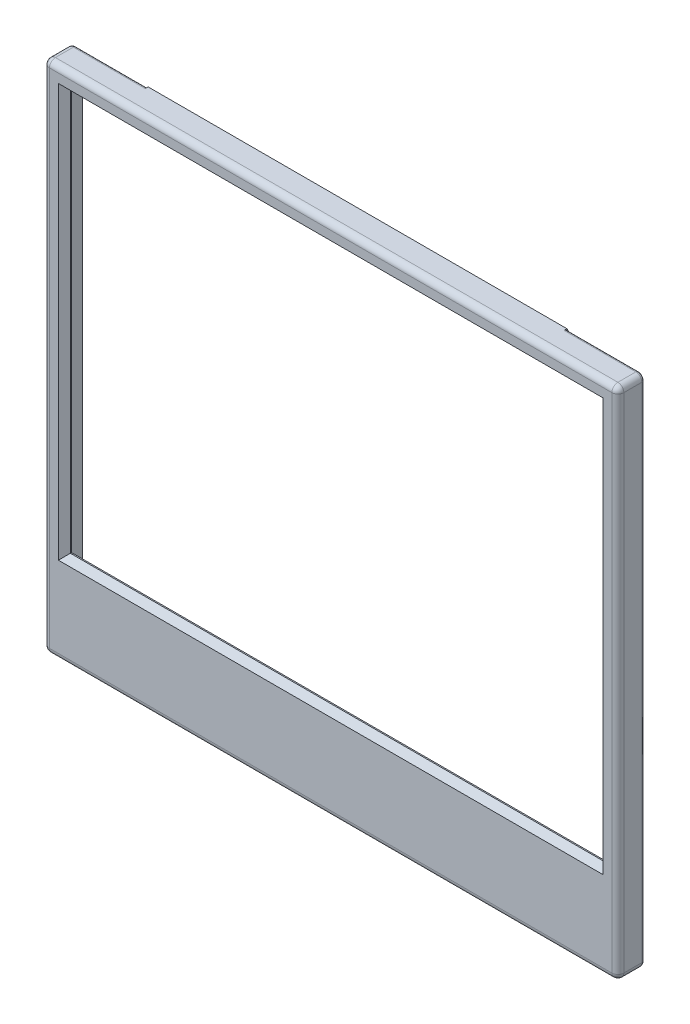
from build123d import *
from OCP.BRepFilletAPI import BRepFilletAPI_MakeChamfer

# Parameters (mm, degrees)
SKETCH1_W           = 96
SKETCH1_H           = 86
SKETCH1_W_2         = 89
SKETCH1_H_2         = 67
BOSS_EXTRUDE1_DEPTH = 4.5
SKETCH2_W           = 92
SKETCH2_H           = 78
CUT_EXTRUDE1_DEPTH  = 3.3
CHAMFER1_SIZE       = 1
SKETCH3_W           = 14.8
SKETCH3_H           = 6
BOSS_EXTRUDE2_DEPTH = 6
SKETCH4_R           = 1.5
CUT_EXTRUDE2_DEPTH  = 111.902705107
FILLET1_R           = 1
SKETCH6_W           = 10
SKETCH6_H           = 4.2
BOSS_EXTRUDE3_DEPTH = 1
CHAMFER2_SIZE       = 1
CHAMFER2_SIZE2      = 1.962610506
CHAMFER3_SIZE       = 0.5
CHAMFER3_SIZE2      = 0.419549816
FILLET2_R           = 0.5
FILLET3_R           = 0.5
SKETCH7_W           = 8
SKETCH7_H           = 1.5
BOSS_EXTRUDE4_DEPTH = 1.25
CHAMFER4_SIZE       = 0.5
CHAMFER4_SIZE2      = 0.419549816
FILLET6_R           = 0.5


# Some blends are built 0.0001 mm under size
with BuildPart() as part:
    # Sketch1 → Boss-Extrude1 (new body)
    with BuildSketch(Plane.XY):
        with Locations((44.5, 27.5)):
            Rectangle(SKETCH1_W, SKETCH1_H)
        with Locations((44.5, 33.5)):
            Rectangle(SKETCH1_W_2, SKETCH1_H_2, mode=Mode.SUBTRACT)
    extrude(amount=BOSS_EXTRUDE1_DEPTH)

    # Sketch2 → Cut-Extrude1 (cut)
    with BuildSketch(Plane(origin=(0, 0, 0), x_dir=(-1, 0, 0), z_dir=(0, 0, -1))):
        with Locations((-44.5, 29.5)):
            Rectangle(SKETCH2_W, SKETCH2_H)
    extrude(amount=-CUT_EXTRUDE1_DEPTH, mode=Mode.SUBTRACT)

    # Chamfer1
    chamfer1_edges = [part.edges().sort_by_distance(p)[0] for p in [
        (0, 33.5, 4.5),
        (44.5, 0, 4.5),
        (89, 33.5, 4.5),
        (44.5, 67, 4.5),
    ]]
    chamfer(chamfer1_edges, length=CHAMFER1_SIZE)

    # Sketch3 → Boss-Extrude2 (add)
    with BuildSketch(Plane(origin=(0, 0, 0), x_dir=(-1, 0, 0), z_dir=(0, 0, -1))):
        with Locations((-14.5, -12.5)):
            Rectangle(SKETCH3_W, SKETCH3_H)
        with Locations((-74.5, -12.5)):
            Rectangle(SKETCH3_W, SKETCH3_H)
        with Locations((-44.5, -12.5)):
            Rectangle(SKETCH3_W, SKETCH3_H)
    extrude(amount=BOSS_EXTRUDE2_DEPTH)

    # Sketch4 → Cut-Extrude2 (cut, through all)
    with BuildSketch(Plane.ZY.offset(-7.1)):
        with BuildLine():
            ThreePointArc((-6, -12.5), (-5.121320344, -10.378679656), (-3, -9.5))
            Line((-3, -9.5), (-6, -9.5))
            Line((-6, -9.5), (-6, -12.5))
        make_face()
        with BuildLine():
            ThreePointArc((-3, -15.5), (-5.121320344, -14.621320344), (-6, -12.5))
            Line((-6, -12.5), (-6, -15.5))
            Line((-6, -15.5), (-3, -15.5))
        make_face()
        with Locations((-3, -12.5)):
            Circle(SKETCH4_R)
    extrude(amount=-CUT_EXTRUDE2_DEPTH, mode=Mode.SUBTRACT)

    # Fillet1
    fillet1_edges = [part.edges().sort_by_distance(p)[0] for p in [
        (92.5, 27.5, 4.5),
        (44.5, 70.5, 4.5),
        (-3.5, 27.5, 4.5),
        (-3.5, 70.5, 2.25),
        (92.5, 70.5, 2.25),
        (92.5, -15.5, 2.25),
        (-3.5, -15.5, 2.25),
        (44.5, -15.5, 4.5),
    ]]
    fillet(fillet1_edges, radius=FILLET1_R)

    # Sketch6 → Boss-Extrude3 (add)
    with BuildSketch(Plane(origin=(0, 0, 0), x_dir=(-1, 0, 0), z_dir=(0, 0, -1))):
        with Locations((-74.5, 68.4)):
            Rectangle(SKETCH6_W, SKETCH6_H)
        with Locations((-14.5, 68.4)):
            Rectangle(SKETCH6_W, SKETCH6_H)
        with Locations((-44.5, 68.4)):
            Rectangle(SKETCH6_W, SKETCH6_H)
    extrude(amount=BOSS_EXTRUDE3_DEPTH)

    # Chamfer2
    chamfer2_edges = [part.edges().sort_by_distance(p)[0] for p in [
        (14.5, 70.5, -1),
        (44.5, 70.5, -1),
        (74.5, 70.5, -1),
    ]]
    chamfer2_side = [part.faces().sort_by_distance(p)[0] for p in [
        (44.5, 70.5, 1.561977716),
    ]]
    chamfer(chamfer2_edges, length=CHAMFER2_SIZE, length2=CHAMFER2_SIZE2, reference=chamfer2_side[0])

    # Chamfer3: one chamfer whose edges measure the first distance from different faces: ONE call of the kernel's chamfer builder (chamfer() names one face for all edges)
    chamfer3_edges_1 = [part.edges().sort_by_distance(p)[0] for p in [
        (74.5, 66.3, 0),
    ]]
    chamfer3_side_1 = [part.faces().sort_by_distance(p)[0] for p in [
        (74.5, 67.4, 0),
    ]]
    chamfer3_edges_2 = [part.edges().sort_by_distance(p)[0] for p in [
        (14.5, 66.3, 0),
    ]]
    chamfer3_side_2 = [part.faces().sort_by_distance(p)[0] for p in [
        (14.5, 67.4, 0),
    ]]
    chamfer3_edges_3 = [part.edges().sort_by_distance(p)[0] for p in [
        (44.5, 66.3, 0),
    ]]
    chamfer3_side_3 = [part.faces().sort_by_distance(p)[0] for p in [
        (44.5, 67.4, 0),
    ]]
    chamfer3 = BRepFilletAPI_MakeChamfer(part.part.solid().wrapped)
    for e in chamfer3_edges_1:
        chamfer3.Add(CHAMFER3_SIZE, CHAMFER3_SIZE2, e.wrapped, chamfer3_side_1[0].wrapped)  # the first distance lies on this face
    for e in chamfer3_edges_2:
        chamfer3.Add(CHAMFER3_SIZE, CHAMFER3_SIZE2, e.wrapped, chamfer3_side_2[0].wrapped)  # the first distance lies on this face
    for e in chamfer3_edges_3:
        chamfer3.Add(CHAMFER3_SIZE, CHAMFER3_SIZE2, e.wrapped, chamfer3_side_3[0].wrapped)  # the first distance lies on this face
    add(Compound.cast(chamfer3.Shape()), mode=Mode.REPLACE)

    # Fillet2
    # the kernel refuses this fillet: 0.5 mm, written as the material it adds along each edge
    with BuildSketch(Plane(origin=(7.1, -9.5, 0), x_dir=(-1, 0, 0), z_dir=(0, -1, 0)), Plane(origin=(81.9, -15.5, 0), x_dir=(1, 0, 0), z_dir=(0, 1, 0)), Plane(origin=(37.1, -15.5, 0), x_dir=(0, 0, -1), z_dir=(0, 1, 0))) as fillet2_piece_1:
        with BuildLine():
            CenterArc((FILLET2_R, FILLET2_R), FILLET2_R, 180, 90)
            Line((0, FILLET2_R), (0, 0))
            Line((0, 0), (FILLET2_R, 0))
        make_face()
    extrude(amount=6)
    with BuildSketch(Plane(origin=(21.9, -15.5, 0), x_dir=(0, 0, -1), z_dir=(0, 1, 0)), Plane(origin=(67.1, -9.5, 0), x_dir=(0, 0, -1), z_dir=(0, -1, 0)), Plane(origin=(51.9, -9.5, 0), x_dir=(1, 0, 0), z_dir=(0, -1, 0))) as fillet2_piece_2:
        with BuildLine():
            CenterArc((FILLET2_R, -FILLET2_R), FILLET2_R, 90, 90)
            Line((0, -FILLET2_R), (0, 0))
            Line((0, 0), (FILLET2_R, 0))
        make_face()
    extrude(amount=6)
    # the kernel refuses this fillet: 0.5 mm, written as the material it takes off along each edge
    with BuildSketch(Plane(origin=(51.9, -15.5, -0.5), x_dir=(-1, 0, 0), z_dir=(0, 0, -1)), Plane(origin=(81.9, -15.5, -0.5), x_dir=(-1, 0, 0), z_dir=(0, 0, -1)), Plane(origin=(21.9, -15.5, -0.5), x_dir=(-1, 0, 0), z_dir=(0, 0, -1)), Plane(origin=(67.1, -9.5, -0.5), x_dir=(1, 0, 0), z_dir=(0, 0, -1)), Plane(origin=(37.1, -9.5, -0.5), x_dir=(1, 0, 0), z_dir=(0, 0, -1)), Plane(origin=(7.1, -9.5, -0.5), x_dir=(1, 0, 0), z_dir=(0, 0, -1))) as fillet2_2_piece_1:
        with BuildLine():
            CenterArc((FILLET2_R, FILLET2_R), FILLET2_R, 180, 90)
            Line((0, FILLET2_R), (0, 0))
            Line((0, 0), (FILLET2_R, 0))
        make_face()
    extrude(amount=2.5, mode=Mode.SUBTRACT)
    with BuildSketch(Plane(origin=(37.1, -15.5, -0.5), x_dir=(1, 0, 0), z_dir=(0, 0, -1)), Plane(origin=(67.1, -15.5, -0.5), x_dir=(1, 0, 0), z_dir=(0, 0, -1)), Plane(origin=(7.1, -15.5, -0.5), x_dir=(1, 0, 0), z_dir=(0, 0, -1)), Plane(origin=(81.9, -9.5, -0.5), x_dir=(-1, 0, 0), z_dir=(0, 0, -1)), Plane(origin=(51.9, -9.5, -0.5), x_dir=(-1, 0, 0), z_dir=(0, 0, -1)), Plane(origin=(21.9, -9.5, -0.5), x_dir=(-1, 0, 0), z_dir=(0, 0, -1))) as fillet2_2_piece_2:
        with BuildLine():
            CenterArc((FILLET2_R, -FILLET2_R), FILLET2_R, 90, 90)
            Line((0, -FILLET2_R), (0, 0))
            Line((0, 0), (FILLET2_R, 0))
        make_face()
    extrude(amount=2.5, mode=Mode.SUBTRACT)
    with BuildSketch(Plane(origin=(7.1, -12.5, -3), x_dir=(0, -1, 0), z_dir=(0, 0, 1))) as fillet2_2_piece_3:
        with BuildLine():
            CenterArc((3 - FILLET2_R, FILLET2_R), FILLET2_R, 270, 90)
            Line((3, FILLET2_R), (3, 0))
            Line((3, 0), (3 - FILLET2_R, 0))
        make_face()
    revolve(axis=Axis((7.1, -12.5, -3), (1, 0, 0)), revolution_arc=180, mode=Mode.SUBTRACT)
    with BuildSketch(Plane(origin=(81.9, -12.5, -3), x_dir=(0, -1, 0), z_dir=(0, 0, 1))) as fillet2_2_piece_4:
        with BuildLine():
            CenterArc((3 - FILLET2_R, -FILLET2_R), FILLET2_R, 0, 90)
            Line((3, -FILLET2_R), (3, 0))
            Line((3, 0), (3 - FILLET2_R, 0))
        make_face()
    revolve(axis=Axis((81.9, -12.5, -3), (1, 0, 0)), revolution_arc=180, mode=Mode.SUBTRACT)
    with BuildSketch(Plane(origin=(21.9, -12.5, -3), x_dir=(0, -1, 0), z_dir=(0, 0, 1))) as fillet2_2_piece_5:
        with BuildLine():
            CenterArc((3 - FILLET2_R, -FILLET2_R), FILLET2_R, 0, 90)
            Line((3 - FILLET2_R, 0), (3, 0))
            Line((3, 0), (3, -FILLET2_R))
        make_face()
    revolve(axis=Axis((21.9, -12.5, -3), (1, 0, 0)), revolution_arc=180, mode=Mode.SUBTRACT)
    with BuildSketch(Plane(origin=(37.1, -12.5, -3), x_dir=(0, -1, 0), z_dir=(0, 0, 1))) as fillet2_2_piece_6:
        with BuildLine():
            CenterArc((3 - FILLET2_R, FILLET2_R), FILLET2_R, 270, 90)
            Line((3 - FILLET2_R, 0), (3, 0))
            Line((3, 0), (3, FILLET2_R))
        make_face()
    revolve(axis=Axis((37.1, -12.5, -3), (1, 0, 0)), revolution_arc=180, mode=Mode.SUBTRACT)
    with BuildSketch(Plane(origin=(67.1, -12.5, -3), x_dir=(0, -1, 0), z_dir=(0, 0, 1))) as fillet2_2_piece_7:
        with BuildLine():
            CenterArc((3 - FILLET2_R, FILLET2_R), FILLET2_R, 270, 90)
            Line((3 - FILLET2_R, 0), (3, 0))
            Line((3, 0), (3, FILLET2_R))
        make_face()
    revolve(axis=Axis((67.1, -12.5, -3), (1, 0, 0)), revolution_arc=180, mode=Mode.SUBTRACT)
    with BuildSketch(Plane(origin=(51.9, -12.5, -3), x_dir=(0, -1, 0), z_dir=(0, 0, 1))) as fillet2_2_piece_8:
        with BuildLine():
            CenterArc((3 - FILLET2_R, -FILLET2_R), FILLET2_R, 0, 90)
            Line((3, -FILLET2_R), (3, 0))
            Line((3, 0), (3 - FILLET2_R, 0))
        make_face()
    revolve(axis=Axis((51.9, -12.5, -3), (1, 0, 0)), revolution_arc=180, mode=Mode.SUBTRACT)
    with BuildSketch(Plane(origin=(92.5, 69.5, 0), x_dir=(-1, 0, 0), z_dir=(0, -1, 0)), Plane(origin=(-3.5, -14.5, 0), x_dir=(1, 0, 0), z_dir=(0, 1, 0))) as fillet2_2_piece_9:
        with BuildLine():
            CenterArc((FILLET2_R, -FILLET2_R), FILLET2_R, 90, 90)
            Line((0, -FILLET2_R), (0, 0))
            Line((0, 0), (FILLET2_R, 0))
        make_face()
    extrude(amount=84, mode=Mode.SUBTRACT)
    with BuildSketch(Plane(origin=(6.6, -15.5, 0), x_dir=(0, 1, 0), z_dir=(-1, 0, 0)), Plane(origin=(91.5, -15.5, 0), x_dir=(0, 1, 0), z_dir=(-1, 0, 0))) as fillet2_2_piece_10:
        with BuildLine():
            CenterArc((FILLET2_R, -FILLET2_R), FILLET2_R, 90, 90)
            Line((0, -FILLET2_R), (0, 0))
            Line((0, 0), (FILLET2_R, 0))
        make_face()
    extrude(amount=9.1, mode=Mode.SUBTRACT)
    with BuildSketch(Plane(origin=(79.5, 70.5, 0), x_dir=(0, 0, 1), z_dir=(1, 0, 0)), Plane(origin=(-2.5, 70.5, 0), x_dir=(0, 0, 1), z_dir=(1, 0, 0))) as fillet2_2_piece_11:
        with BuildLine():
            CenterArc((FILLET2_R, FILLET2_R), FILLET2_R, 180, 90)
            Line((0, FILLET2_R), (0, 0))
            Line((0, 0), (FILLET2_R, 0))
        make_face()
    extrude(amount=12, mode=Mode.SUBTRACT)
    with BuildSketch(Plane(origin=(-2.5, 69.5, 0), x_dir=(-1, 0, 0), z_dir=(0, -1, 0))) as fillet2_2_piece_12:
        with BuildLine():
            CenterArc((1 - FILLET2_R, -FILLET2_R), FILLET2_R, 0, 90)
            Line((1, -FILLET2_R), (1, 0))
            Line((1, 0), (1 - FILLET2_R, 0))
        make_face()
    revolve(axis=Axis((-2.5, 69.5, 0), (0, 0, -1)), revolution_arc=90, mode=Mode.SUBTRACT)
    with BuildSketch(Plane(origin=(-2.5, -14.5, 0), x_dir=(-1, 0, 0), z_dir=(0, 1, 0))) as fillet2_2_piece_13:
        with BuildLine():
            CenterArc((1 - FILLET2_R, FILLET2_R), FILLET2_R, 270, 90)
            Line((1, FILLET2_R), (1, 0))
            Line((1, 0), (1 - FILLET2_R, 0))
        make_face()
    revolve(axis=Axis((-2.5, -14.5, 0), (0, 0, 1)), revolution_arc=90, mode=Mode.SUBTRACT)
    with BuildSketch(Plane(origin=(91.5, -14.5, 0), x_dir=(0, -1, 0), z_dir=(-1, 0, 0))) as fillet2_2_piece_14:
        with BuildLine():
            CenterArc((1 - FILLET2_R, FILLET2_R), FILLET2_R, 270, 90)
            Line((1, FILLET2_R), (1, 0))
            Line((1, 0), (1 - FILLET2_R, 0))
        make_face()
    revolve(axis=Axis((91.5, -14.5, 0), (0, 0, 1)), revolution_arc=90, mode=Mode.SUBTRACT)
    with BuildSketch(Plane(origin=(91.5, 69.5, 0), x_dir=(1, 0, 0), z_dir=(0, -1, 0))) as fillet2_2_piece_15:
        with BuildLine():
            CenterArc((1 - FILLET2_R, FILLET2_R), FILLET2_R, 270, 90)
            Line((1, FILLET2_R), (1, 0))
            Line((1, 0), (1 - FILLET2_R, 0))
        make_face()
    revolve(axis=Axis((91.5, 69.5, 0), (0, 0, 1)), revolution_arc=90, mode=Mode.SUBTRACT)
    with BuildSketch(Plane(origin=(90.5, -9.5, 0), x_dir=(0, -1, 0), z_dir=(-1, 0, 0)), Plane(origin=(6.6, -9.5, 0), x_dir=(0, -1, 0), z_dir=(-1, 0, 0))) as fillet2_2_piece_16:
        with BuildLine():
            CenterArc((FILLET2_R, FILLET2_R), FILLET2_R, 180, 90)
            Line((0, FILLET2_R), (0, 0))
            Line((0, 0), (FILLET2_R, 0))
        make_face()
    extrude(amount=8.1, mode=Mode.SUBTRACT)
    with BuildSketch(Plane(origin=(36.6, -15.5, 0), x_dir=(0, 0, 1), z_dir=(-1, 0, 0)), Plane(origin=(66.6, -15.5, 0), x_dir=(0, 0, 1), z_dir=(-1, 0, 0))) as fillet2_2_piece_17:
        with BuildLine():
            CenterArc((FILLET2_R, FILLET2_R), FILLET2_R, 180, 90)
            Line((0, FILLET2_R), (0, 0))
            Line((0, 0), (FILLET2_R, 0))
        make_face()
    extrude(amount=14.2, mode=Mode.SUBTRACT)
    with BuildSketch(Plane(origin=(66.6, -9.5, 0), x_dir=(0, 0, 1), z_dir=(-1, 0, 0)), Plane(origin=(36.6, -9.5, 0), x_dir=(0, 0, 1), z_dir=(-1, 0, 0))) as fillet2_2_piece_18:
        with BuildLine():
            CenterArc((FILLET2_R, -FILLET2_R), FILLET2_R, 90, 90)
            Line((0, -FILLET2_R), (0, 0))
            Line((0, 0), (FILLET2_R, 0))
        make_face()
    extrude(amount=14.2, mode=Mode.SUBTRACT)
    with BuildSketch(Plane(origin=(66.6, -15.5, -0.5), x_dir=(1, 0, 0), z_dir=(0, 0, -1))) as fillet2_2_piece_19:
        with BuildLine():
            CenterArc((0.5 + FILLET2_R, -FILLET2_R), FILLET2_R, 90, 90)
            Line((0.5, -FILLET2_R), (0.5, 0))
            Line((0.5, 0), (0.5 + FILLET2_R, 0))
        make_face()
    revolve(axis=Axis((66.6, -15.5, -0.5), (0, -1, 0)), revolution_arc=90, mode=Mode.SUBTRACT)
    with BuildSketch(Plane(origin=(52.4, -15.5, -0.5), x_dir=(0, 0, 1), z_dir=(1, 0, 0))) as fillet2_2_piece_20:
        with BuildLine():
            CenterArc((0.5 + FILLET2_R, -FILLET2_R), FILLET2_R, 90, 90)
            Line((0.5, -FILLET2_R), (0.5, 0))
            Line((0.5, 0), (0.5 + FILLET2_R, 0))
        make_face()
    revolve(axis=Axis((52.4, -15.5, -0.5), (0, -1, 0)), revolution_arc=90, mode=Mode.SUBTRACT)
    with BuildSketch(Plane(origin=(36.6, -9.5, -0.5), x_dir=(1, 0, 0), z_dir=(0, 0, -1))) as fillet2_2_piece_21:
        with BuildLine():
            CenterArc((0.5 + FILLET2_R, FILLET2_R), FILLET2_R, 180, 90)
            Line((0.5, FILLET2_R), (0.5, 0))
            Line((0.5, 0), (0.5 + FILLET2_R, 0))
        make_face()
    revolve(axis=Axis((36.6, -9.5, -0.5), (0, -1, 0)), revolution_arc=90, mode=Mode.SUBTRACT)
    with BuildSketch(Plane(origin=(22.4, -9.5, -0.5), x_dir=(-1, 0, 0), z_dir=(0, 0, -1))) as fillet2_2_piece_22:
        with BuildLine():
            CenterArc((0.5 + FILLET2_R, -FILLET2_R), FILLET2_R, 90, 90)
            Line((0.5, -FILLET2_R), (0.5, 0))
            Line((0.5, 0), (0.5 + FILLET2_R, 0))
        make_face()
    revolve(axis=Axis((22.4, -9.5, -0.5), (0, 1, 0)), revolution_arc=90, mode=Mode.SUBTRACT)
    with BuildSketch(Plane(origin=(82.4, -15.5, -0.5), x_dir=(0, 0, 1), z_dir=(1, 0, 0))) as fillet2_2_piece_23:
        with BuildLine():
            CenterArc((0.5 + FILLET2_R, -FILLET2_R), FILLET2_R, 90, 90)
            Line((0.5, -FILLET2_R), (0.5, 0))
            Line((0.5, 0), (0.5 + FILLET2_R, 0))
        make_face()
    revolve(axis=Axis((82.4, -15.5, -0.5), (0, -1, 0)), revolution_arc=90, mode=Mode.SUBTRACT)
    with BuildSketch(Plane(origin=(66.6, -9.5, -0.5), x_dir=(1, 0, 0), z_dir=(0, 0, -1))) as fillet2_2_piece_24:
        with BuildLine():
            CenterArc((0.5 + FILLET2_R, FILLET2_R), FILLET2_R, 180, 90)
            Line((0.5, FILLET2_R), (0.5, 0))
            Line((0.5, 0), (0.5 + FILLET2_R, 0))
        make_face()
    revolve(axis=Axis((66.6, -9.5, -0.5), (0, -1, 0)), revolution_arc=90, mode=Mode.SUBTRACT)
    with BuildSketch(Plane(origin=(52.4, -9.5, -0.5), x_dir=(0, 0, 1), z_dir=(1, 0, 0))) as fillet2_2_piece_25:
        with BuildLine():
            CenterArc((0.5 + FILLET2_R, FILLET2_R), FILLET2_R, 180, 90)
            Line((0.5, FILLET2_R), (0.5, 0))
            Line((0.5, 0), (0.5 + FILLET2_R, 0))
        make_face()
    revolve(axis=Axis((52.4, -9.5, -0.5), (0, -1, 0)), revolution_arc=90, mode=Mode.SUBTRACT)
    with BuildSketch(Plane(origin=(36.6, -15.5, -0.5), x_dir=(1, 0, 0), z_dir=(0, 0, -1))) as fillet2_2_piece_26:
        with BuildLine():
            CenterArc((0.5 + FILLET2_R, -FILLET2_R), FILLET2_R, 90, 90)
            Line((0.5, -FILLET2_R), (0.5, 0))
            Line((0.5, 0), (0.5 + FILLET2_R, 0))
        make_face()
    revolve(axis=Axis((36.6, -15.5, -0.5), (0, -1, 0)), revolution_arc=90, mode=Mode.SUBTRACT)
    with BuildSketch(Plane(origin=(22.4, -15.5, -0.5), x_dir=(-1, 0, 0), z_dir=(0, 0, -1))) as fillet2_2_piece_27:
        with BuildLine():
            CenterArc((0.5 + FILLET2_R, FILLET2_R), FILLET2_R, 180, 90)
            Line((0.5, FILLET2_R), (0.5, 0))
            Line((0.5, 0), (0.5 + FILLET2_R, 0))
        make_face()
    revolve(axis=Axis((22.4, -15.5, -0.5), (0, 1, 0)), revolution_arc=90, mode=Mode.SUBTRACT)
    with BuildSketch(Plane(origin=(6.6, -9.5, -0.5), x_dir=(0, 0, 1), z_dir=(-1, 0, 0))) as fillet2_2_piece_28:
        with BuildLine():
            CenterArc((0.5 + FILLET2_R, -FILLET2_R), FILLET2_R, 90, 90)
            Line((0.5 + FILLET2_R, 0), (0.5, 0))
            Line((0.5, 0), (0.5, -FILLET2_R))
        make_face()
    revolve(axis=Axis((6.6, -9.5, -0.5), (0, 1, 0)), revolution_arc=90, mode=Mode.SUBTRACT)
    with BuildSketch(Plane(origin=(82.4, -9.5, -0.5), x_dir=(0, 0, 1), z_dir=(1, 0, 0))) as fillet2_2_piece_29:
        with BuildLine():
            CenterArc((0.5 + FILLET2_R, FILLET2_R), FILLET2_R, 180, 90)
            Line((0.5, FILLET2_R), (0.5, 0))
            Line((0.5, 0), (0.5 + FILLET2_R, 0))
        make_face()
    revolve(axis=Axis((82.4, -9.5, -0.5), (0, -1, 0)), revolution_arc=90, mode=Mode.SUBTRACT)
    with BuildSketch(Plane(origin=(6.6, -15.5, -0.5), x_dir=(0, 0, 1), z_dir=(-1, 0, 0))) as fillet2_2_piece_30:
        with BuildLine():
            CenterArc((0.5 + FILLET2_R, FILLET2_R), FILLET2_R, 180, 90)
            Line((0.5, FILLET2_R), (0.5, 0))
            Line((0.5, 0), (0.5 + FILLET2_R, 0))
        make_face()
    revolve(axis=Axis((6.6, -15.5, -0.5), (0, 1, 0)), revolution_arc=90, mode=Mode.SUBTRACT)

    # Fillet3
    # the kernel refuses this fillet: 0.5 mm, written as the material it adds along each edge
    with BuildSketch(Plane(origin=(9.5, 68.5, 0), x_dir=(0, 0, 1), z_dir=(1, 0, 0)), Plane(origin=(39.5, 68.5, 0), x_dir=(0, 0, 1), z_dir=(1, 0, 0)), Plane(origin=(69.5, 68.5, 0), x_dir=(0, 0, 1), z_dir=(1, 0, 0))) as fillet3_piece_1:
        with BuildLine():
            CenterArc((FILLET3_R, FILLET3_R), FILLET3_R, 180, 90)
            Line((0, FILLET3_R), (0, 0))
            Line((0, 0), (FILLET3_R, 0))
        make_face()
    extrude(amount=10)
    # the kernel refuses this fillet: 0.5 mm, written as the material it takes off along each edge
    with BuildSketch(Plane(origin=(8.25, 66.3, -1), x_dir=(0, 0, 1), z_dir=(1, 0, 0)), Plane(origin=(38.25, 66.3, -1), x_dir=(0, 0, 1), z_dir=(1, 0, 0)), Plane(origin=(68.25, 66.3, -1), x_dir=(0, 0, 1), z_dir=(1, 0, 0))) as fillet3_2_piece_1:
        with BuildLine():
            CenterArc((FILLET3_R, -FILLET3_R), FILLET3_R, 90, 90)
            Line((0, -FILLET3_R), (0, 0))
            Line((0, 0), (FILLET3_R, 0))
        make_face()
    extrude(amount=12.5, mode=Mode.SUBTRACT)
    with BuildSketch(Plane(origin=(19.5, 65.05, -1), x_dir=(0, 0, 1), z_dir=(0, 1, 0)), Plane(origin=(9.5, 69.787389494, -1), x_dir=(0, 0, 1), z_dir=(0, -1, 0)), Plane(origin=(49.5, 65.05, -1), x_dir=(0, 0, 1), z_dir=(0, 1, 0)), Plane(origin=(39.5, 69.787389494, -1), x_dir=(0, 0, 1), z_dir=(0, -1, 0)), Plane(origin=(79.5, 65.05, -1), x_dir=(0, 0, 1), z_dir=(0, 1, 0)), Plane(origin=(69.5, 69.787389494, -1), x_dir=(0, 0, 1), z_dir=(0, -1, 0))) as fillet3_2_piece_2:
        with BuildLine():
            CenterArc((FILLET3_R, -FILLET3_R), FILLET3_R, 90, 90)
            Line((0, -FILLET3_R), (0, 0))
            Line((0, 0), (FILLET3_R, 0))
        make_face()
    extrude(amount=4.737389494, mode=Mode.SUBTRACT)
    with BuildSketch(Plane(origin=(19.800098449, 68.537389494, -1), x_dir=(-1.2661964265537974e-15, 0.8910065241883646, 0.45399049973955324), z_dir=(-1, 0, 0)), Plane(origin=(49.800098449, 68.537389494, -1), x_dir=(0, 0.8910065241883545, 0.45399049973957306), z_dir=(-1, 0, 0))) as fillet3_2_piece_3:
        with BuildLine():
            CenterArc((FILLET3_R * 0.24007875908, -FILLET3_R), FILLET3_R, 90, 27)
            Line((-FILLET3_R * 0.213911740659, -FILLET3_R * 0.108993475812), (0, 0))
            Line((0, 0), (FILLET3_R * 0.24007875908, 0))
        make_face()
    extrude(amount=10.600196898, mode=Mode.SUBTRACT)
    with BuildSketch(Plane(origin=(79.800098449, 68.537389494, -1), x_dir=(0, -1, 0), z_dir=(-1, 0, 0))) as fillet3_2_piece_4:
        with BuildLine():
            CenterArc((FILLET3_R * 0.24007875908, FILLET3_R), FILLET3_R, 243, 27)
            Line((-FILLET3_R * 0.213911740659, FILLET3_R * 0.108993475812), (0, 0))
            Line((0, 0), (FILLET3_R * 0.24007875908, 0))
        make_face()
    extrude(amount=10.600196898, mode=Mode.SUBTRACT)
    with BuildSketch(Plane(origin=(68.917115427, 66.3, -0.419549816), x_dir=(0, 0, -1), z_dir=(1, 0, 0)), Plane(origin=(8.917115427, 66.3, -0.419549816), x_dir=(0, 0, -1), z_dir=(1, 0, 0)), Plane(origin=(38.917115427, 66.3, -0.419549816), x_dir=(0, 0, -1), z_dir=(1, 0, 0))) as fillet3_2_piece_5:
        with BuildLine():
            CenterArc((FILLET3_R * 0.466307658155, FILLET3_R), FILLET3_R, 220, 50)
            Line((-FILLET3_R * 0.299736784964, FILLET3_R * 0.357212390313), (0, 0))
            Line((0, 0), (FILLET3_R * 0.466307658155, 0))
        make_face()
    extrude(amount=11.165769145, mode=Mode.SUBTRACT)
    with BuildSketch(Plane(origin=(69.5, 67.757555554, 0.803484512), x_dir=(0, 0.6427876096865406, -0.766044443118977), z_dir=(0, -0.766044443118977, -0.6427876096865407)), Plane(origin=(9.5, 67.757555554, 0.803484512), x_dir=(0, 0.6427876096865406, -0.766044443118977), z_dir=(0, -0.766044443118977, -0.6427876096865407)), Plane(origin=(39.5, 67.757555554, 0.803484512), x_dir=(0, 0.6427876096865406, -0.766044443118977), z_dir=(-1.2959697960180564e-15, -0.766044443118977, -0.6427876096865407))) as fillet3_2_piece_6:
        with BuildLine():
            CenterArc((FILLET3_R, FILLET3_R), FILLET3_R, 180, 90)
            Line((0, FILLET3_R), (0, 0))
            Line((0, 0), (FILLET3_R, 0))
        make_face()
    extrude(amount=3.152703645, mode=Mode.SUBTRACT)
    with BuildSketch(Plane(origin=(69.045037207, 66.8, 0), x_dir=(0, 1, 0), z_dir=(1, 0, 0)), Plane(origin=(39.045037207, 66.8, 0), x_dir=(0, 1, 0), z_dir=(1, 0, 0))) as fillet3_2_piece_7:
        with BuildLine():
            CenterArc((FILLET3_R * 0.363970234266, -FILLET3_R), FILLET3_R, 90, 40)
            Line((-FILLET3_R * 0.27881737542, -FILLET3_R * 0.233955556881), (0, 0))
            Line((0, 0), (FILLET3_R * 0.363970234266, 0))
        make_face()
    extrude(amount=10.909925586, mode=Mode.SUBTRACT)
    with BuildSketch(Plane(origin=(79.5, 67.757555554, 0.803484512), x_dir=(0, 0.6427876096865406, -0.766044443118977), z_dir=(0, -0.766044443118977, -0.6427876096865407)), Plane(origin=(19.5, 67.757555554, 0.803484512), x_dir=(0, 0.6427876096865406, -0.766044443118977), z_dir=(0, -0.766044443118977, -0.6427876096865407)), Plane(origin=(49.5, 67.757555554, 0.803484512), x_dir=(0, 0.6427876096865406, -0.766044443118977), z_dir=(0, -0.766044443118977, -0.6427876096865407))) as fillet3_2_piece_8:
        with BuildLine():
            CenterArc((FILLET3_R, -FILLET3_R), FILLET3_R, 90, 90)
            Line((0, -FILLET3_R), (0, 0))
            Line((0, 0), (FILLET3_R, 0))
        make_face()
    extrude(amount=3.152703645, mode=Mode.SUBTRACT)
    with BuildSketch(Plane(origin=(9.045037207, 66.8, 0), x_dir=(0, -0.7660444431189817, -0.642787609686535), z_dir=(1, 0, 0))) as fillet3_2_piece_9:
        with BuildLine():
            CenterArc((FILLET3_R * 0.363970234266, FILLET3_R), FILLET3_R, 230, 40)
            Line((-FILLET3_R * 0.27881737542, FILLET3_R * 0.233955556881), (0, 0))
            Line((0, 0), (FILLET3_R * 0.363970234266, 0))
        make_face()
    extrude(amount=10.909925586, mode=Mode.SUBTRACT)

    # Sketch7 → Boss-Extrude4 (add)
    with BuildSketch(Plane(origin=(0, -9.5, 0), x_dir=(1, 0, 0), z_dir=(0, 1, 0))):
        with Locations((44.5, 0.75)):
            Rectangle(SKETCH7_W, SKETCH7_H)
        with Locations((74.5, 0.75)):
            Rectangle(SKETCH7_W, SKETCH7_H)
        with Locations((14.5, 0.75)):
            Rectangle(SKETCH7_W, SKETCH7_H)
    extrude(amount=BOSS_EXTRUDE4_DEPTH)

    # Chamfer4: one chamfer whose edges measure the first distance from different faces: ONE call of the kernel's chamfer builder (chamfer() names one face for all edges)
    chamfer4_edges_1 = [part.edges().sort_by_distance(p)[0] for p in [
        (44.5, -8.25, 0),
    ]]
    chamfer4_side_1 = [part.faces().sort_by_distance(p)[0] for p in [
        (44.5, -8.875, 0),
    ]]
    chamfer4_edges_2 = [part.edges().sort_by_distance(p)[0] for p in [
        (74.5, -8.25, 0),
    ]]
    chamfer4_side_2 = [part.faces().sort_by_distance(p)[0] for p in [
        (74.5, -8.875, 0),
    ]]
    chamfer4_edges_3 = [part.edges().sort_by_distance(p)[0] for p in [
        (14.5, -8.25, 0),
    ]]
    chamfer4_side_3 = [part.faces().sort_by_distance(p)[0] for p in [
        (14.5, -8.875, 0),
    ]]
    chamfer4 = BRepFilletAPI_MakeChamfer(part.part.solid().wrapped)
    for e in chamfer4_edges_1:
        chamfer4.Add(CHAMFER4_SIZE, CHAMFER4_SIZE2, e.wrapped, chamfer4_side_1[0].wrapped)  # the first distance lies on this face
    for e in chamfer4_edges_2:
        chamfer4.Add(CHAMFER4_SIZE, CHAMFER4_SIZE2, e.wrapped, chamfer4_side_2[0].wrapped)  # the first distance lies on this face
    for e in chamfer4_edges_3:
        chamfer4.Add(CHAMFER4_SIZE, CHAMFER4_SIZE2, e.wrapped, chamfer4_side_3[0].wrapped)  # the first distance lies on this face
    add(Compound.cast(chamfer4.Shape()), mode=Mode.REPLACE)

    # Fillet6
    fillet6_edges = [part.edges().sort_by_distance(p)[0] for p in [
        (18.5, -9.5, -0.75),
        (10.5, -9.5, -0.75),
        (48.5, -9.5, -0.75),
        (40.5, -9.5, -0.75),
        (78.5, -9.5, -0.75),
        (70.5, -9.5, -0.75),
        (18.5, -8.25, -0.959774908),
        (14.5, -8.25, -0.419549816),
        (10.5, -8.25, -0.959774908),
        (78.5, -8.25, -0.959774908),
        (74.5, -8.25, -0.419549816),
        (70.5, -8.25, -0.959774908),
        (48.5, -8.25, -0.959774908),
        (44.5, -8.25, -0.419549816),
        (40.5, -8.25, -0.959774908),
        (18.5, -8.875, -1.5),
        (14.5, -8.25, -1.5),
        (10.5, -8.875, -1.5),
        (14.5, -9.5, -1.5),
        (48.5, -8.875, -1.5),
        (44.5, -8.25, -1.5),
        (40.5, -8.875, -1.5),
        (44.5, -9.5, -1.5),
        (78.5, -8.875, -1.5),
        (74.5, -8.25, -1.5),
        (70.5, -8.875, -1.5),
        (74.5, -9.5, -1.5),
    ]]
    fillet(fillet6_edges, radius=FILLET6_R - 0.0001)  # a hair under: the kernel refuses the full size


solid = part.part
